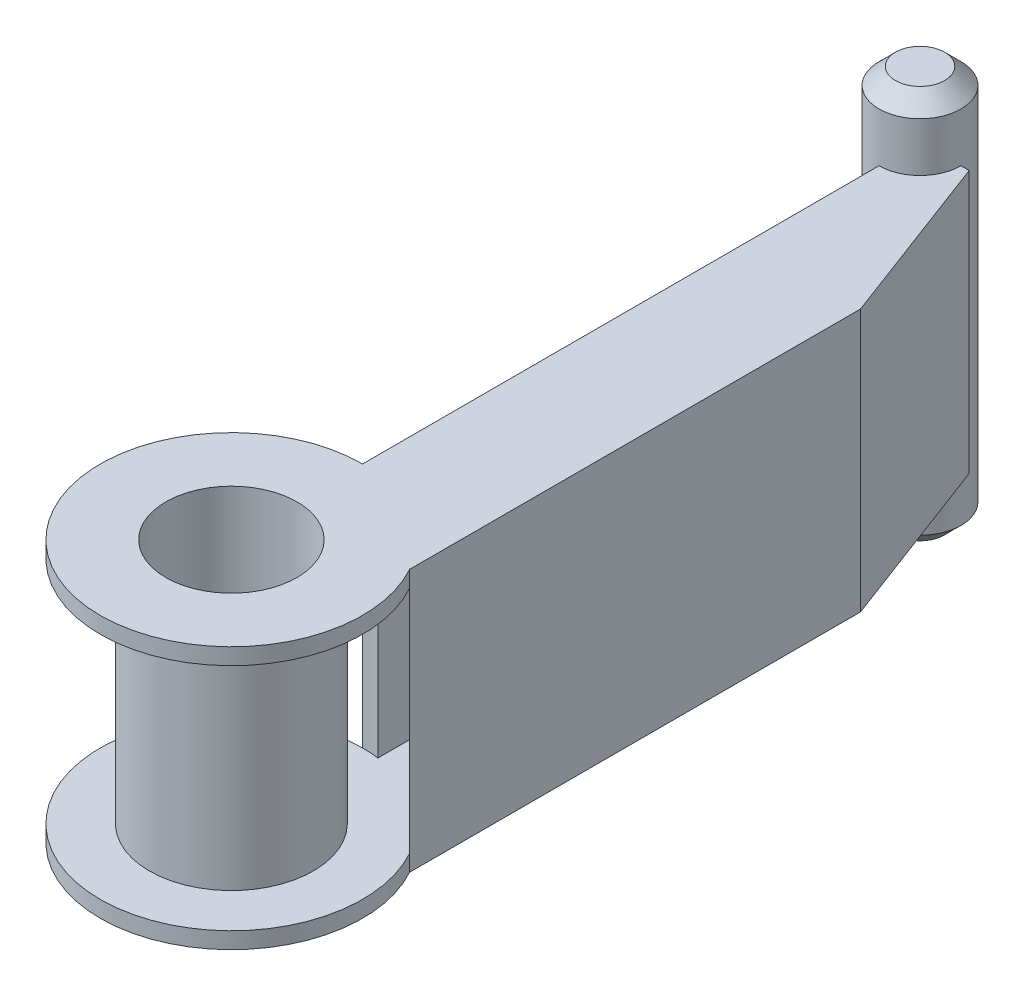
from build123d import *

# Parameters (mm, degrees)
SKETCH1_R                = 8
BOSS_EXTRUDE1_DEPTH      = 32
SHELL3_START             = 2
SHELL3_OUTLINE_R         = 10
SHELL3_DEPTH             = 28
BOSS_EXTRUDE2_DEPTH      = 8
BOSS_EXTRUDE2_DEPTH_BACK = 40
SKETCH2_R                = 5
CHAMFER1_SIZE            = 2


# Read off the part's stored shape, not the designer's step: Shell3
with BuildPart() as part:
    # Sketch1 → Boss-Extrude1 (new body)
    with BuildSketch(Plane(origin=(0, 0, 0), x_dir=(1, 0, 0), z_dir=(0, 1, 0))):
        with BuildLine():
            Line((6, 84), (14, 62.745966692))
            Line((14, 62.745966692), (14, 7.745966692))
            ThreePointArc((14, 7.745966692), (-8.126024025, -13.782878275), (0, 16))
            Line((0, 16), (0, 84))
            Line((0, 84), (6, 84))
        make_face()
        with Locations(Location((0, 0, 0), (0, 0, 270))):
            Circle(SKETCH1_R, mode=Mode.SUBTRACT)
    extrude(amount=BOSS_EXTRUDE1_DEPTH)

    # Shell3 outline → Shell3 (cut)
    with BuildSketch(Plane(origin=(0, 0, 0), x_dir=(1, 0, 0), z_dir=(0, 1, 0)).offset(SHELL3_START)):
        with BuildLine():
            ThreePointArc((2, 15.874507866), (1.001966601, 15.968596148), (0, 16))
            ThreePointArc((0, 16), (-8.126024026, -13.782878275), (14, 7.745966692))
            ThreePointArc((14, 7.745966692), (13.077163184, 9.218882962), (12, 10.583005244))
            Line((12, 10.583005244), (12, 62.382030987))
            Line((12, 62.382030987), (4.615813204, 82))
            Line((4.615813204, 82), (2, 82))
            Line((2, 82), (2, 15.874507866))
        make_face()
        Circle(SHELL3_OUTLINE_R, mode=Mode.SUBTRACT)
    extrude(amount=SHELL3_DEPTH, mode=Mode.SUBTRACT)

    # Sketch2 → Boss-Extrude2 (add, two sides: drawn at the far end of the back side and taken through both)
    with BuildSketch(Plane(origin=(0, 32, 0), x_dir=(1, 0, 0), z_dir=(0, 1, 0)).offset(-BOSS_EXTRUDE2_DEPTH_BACK)):
        with Locations(Location((0, 84, 0), (0, 0, 270))):
            Circle(SKETCH2_R)
    extrude(amount=BOSS_EXTRUDE2_DEPTH + BOSS_EXTRUDE2_DEPTH_BACK)

    # Chamfer1
    chamfer1_edges = [part.edges().sort_by_distance(p)[0] for p in [
        (0, -8, -89),
        (0, 40, -89),
    ]]
    chamfer(chamfer1_edges, length=CHAMFER1_SIZE)


solid = part.part
